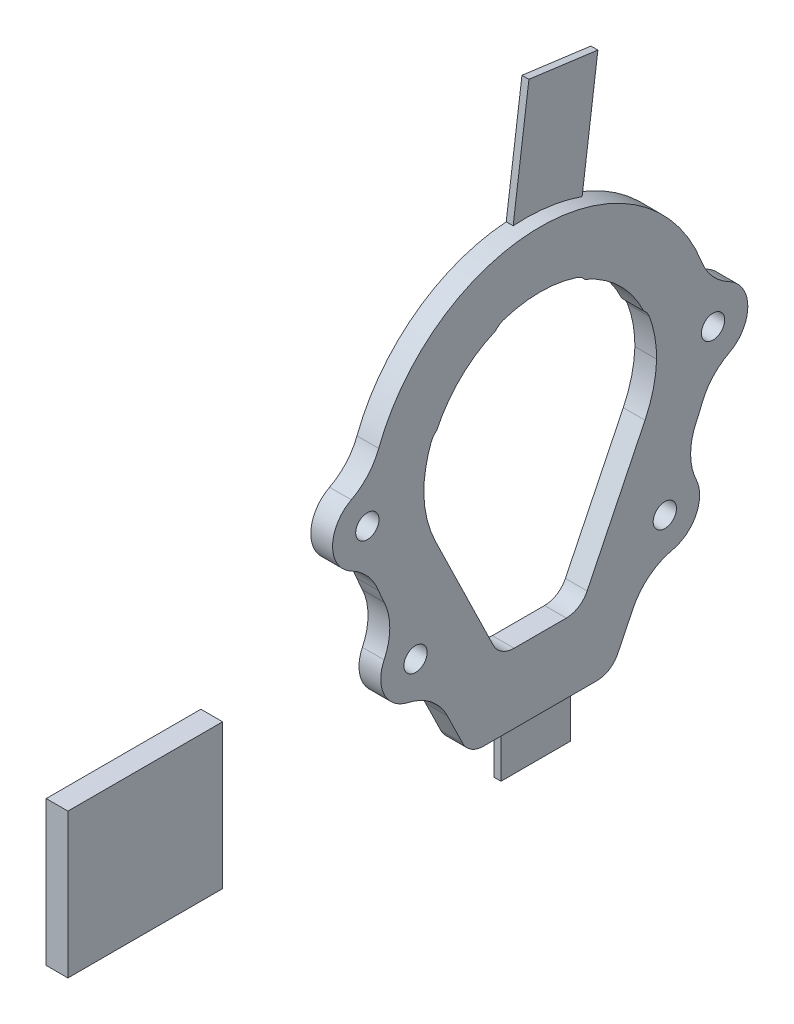
from build123d import *

# Parameters (mm, degrees)
BOSS_EXTRUDE1_DEPTH    = 4.7625
FILLET1_R              = 25.4
FILLET2_R              = 5.08
SKETCH2_R              = 7.62
BOSS_EXTRUDE2_DEPTH    = 4.7625
FILLET3_R              = 12.7
F_10_CLEARANCE_HOLE1_D = 5.1054
SKETCH6_W              = 33.890127471
SKETCH6_H              = 31.661537848
BOSS_EXTRUDE3_DEPTH    = 4.7625
SKETCH7_W              = 15.24
SKETCH7_H              = 11.811391345
BOSS_EXTRUDE4_DEPTH    = 1.524


with BuildPart() as part:
    # Sketch1 → Boss-Extrude1 (new body)
    with BuildSketch(Plane(origin=(0, 0, 0), x_dir=(0, 0, -1), z_dir=(1, 0, 0))):
        with BuildLine():
            Line((-15.600146512, -54.464), (15.600146512, -54.464))
            Line((15.600146512, -54.464), (34.042431289, -16.566091146))
            ThreePointArc((34.042431289, -16.566091146), (0, 37.85924595), (-34.042431289, -16.566091146))
            Line((-34.042431289, -16.566091146), (-15.600146512, -54.464))
        make_face()
        with BuildLine():
            Line((25.508, 0), (25.508, -5.08))
            Line((25.508, -5.08), (10.282855133, -36.366858404))
            ThreePointArc((10.282855133, -36.366858404), (8.408907878, -38.450885226), (5.715, -39.224))
            Line((5.715, -39.224), (-5.715, -39.224))
            ThreePointArc((-5.715, -39.224), (-8.408907878, -38.450885226), (-10.282855133, -36.366858404))
            Line((-10.282855133, -36.366858404), (-25.508, -5.08))
            Line((-25.508, -5.08), (-25.508, 0))
            ThreePointArc((-25.508, 0), (-25.107901196, 4.500151281), (-23.920156064, 8.859130762))
            ThreePointArc((-23.920156064, 8.859130762), (-23.410150406, 9.801984571), (-22.657694676, 10.565456544))
            ThreePointArc((-22.657694676, 10.565456544), (-17.366459261, 17.983495008), (-9.768278212, 23.012621336))
            ThreePointArc((-9.768278212, 23.012621336), (-8.979011, 23.737973903), (-8.018932611, 24.214763756))
            ThreePointArc((-8.018932611, 24.214763756), (0, 25.508), (8.018932611, 24.214763756))
            ThreePointArc((8.018932611, 24.214763756), (8.979011, 23.737973903), (9.768278212, 23.012621336))
            ThreePointArc((9.768278212, 23.012621336), (17.366459261, 17.983495008), (22.657694676, 10.565456544))
            ThreePointArc((22.657694676, 10.565456544), (23.410150406, 9.801984571), (23.920156064, 8.859130762))
            ThreePointArc((23.920156064, 8.859130762), (25.107901196, 4.500151281), (25.508, 0))
        make_face(mode=Mode.SUBTRACT)
    extrude(amount=BOSS_EXTRUDE1_DEPTH)

    # Fillet1
    # the kernel refuses this fillet: 25.4 mm, written as the material it adds along each edge
    with BuildSketch(Plane(origin=(0, -5.08, 25.508), x_dir=(0, -0.8991840813100413, -0.43757055193261923), z_dir=(1, 0, 0))) as fillet1_piece_1:
        with BuildLine():
            CenterArc((5.823492587, 25.4), FILLET1_R, 245.851175762, 24.148824238)
            Line((-4.567855133, 2.222858404), (-4.775682087, 1.759315572))
            ThreePointArc((-4.775682087, 1.759315572), (-2.506213407, 0.654643689), (-0.22228584, -0.456785513))
            Line((-0.22228584, -0.456785513), (0, -0.508))
            Line((0, -0.508), (5.823492587, -0.508))
            Line((5.823492587, -0.508), (5.823492587, 0))
        make_face()
    extrude(amount=4.7625)
    with BuildSketch(Plane(origin=(0, -5.08, -25.508), x_dir=(0, 1, 0), z_dir=(1, 0, 0))) as fillet1_piece_2:
        with BuildLine():
            CenterArc((5.877900188, 25.387464531), FILLET1_R, 244.051024762, 24.148824238)
            Line((-5.236391831, 2.548188865), (-5.458677672, 2.091403352))
            Line((-5.458677672, 2.091403352), (-0.22228584, -0.456785513))
            Line((-0.22228584, -0.456785513), (0, -0.508))
            ThreePointArc((0, -0.508), (2.54, -0.508), (5.064041996, -0.507749291))
            Line((5.064041996, -0.507749291), (5.08, 0))
        make_face()
    extrude(amount=4.7625)

    # Fillet2
    fillet2_edges = [part.edges().sort_by_distance(p)[0] for p in [
        (2.38125, -54.464, -15.600146512),
        (2.38125, -54.464, 15.600146512),
    ]]
    fillet(fillet2_edges, radius=FILLET2_R)

    # Sketch2 → Boss-Extrude2 (add, through all)
    with BuildSketch(Plane(origin=(4.7625, 0, 0), x_dir=(0, 0, -1), z_dir=(1, 0, 0))):
        with Locations((37.85924595, 0)):
            Circle(SKETCH2_R)
        with Locations((-37.85924595, 0)):
            Circle(SKETCH2_R)
        with Locations((-27.305, -30.48)):
            Circle(SKETCH2_R)
        with Locations((27.305, -30.48)):
            Circle(SKETCH2_R)
    extrude(amount=-BOSS_EXTRUDE2_DEPTH)

    # Fillet3
    fillet3_edges = [part.edges().sort_by_distance(p)[0] for p in [
        (2.38125, -7.581315695, -37.092400249),
        (2.38125, 7.581315695, -37.092400249),
        (2.38125, 7.581315695, 37.092400249),
        (2.38125, -7.581315695, 37.092400249),
        (2.38125, -37.318546983, -23.943649801),
        (2.38125, -23.61508868, -30.612172896),
        (2.38125, -23.61508868, 30.612172896),
        (2.38125, -37.318546983, 23.943649801),
    ]]
    fillet(fillet3_edges, radius=FILLET3_R)

    # #10 Clearance Hole1 (through all)
    with Locations(Plane(origin=(4.7625, 0, 0), x_dir=(0, 0, -1), z_dir=(1, 0, 0))):
        with Locations((-37.85924595, 0), (37.85924595, 0), (27.305, -30.48), (-27.305, -30.48)):
            Hole(F_10_CLEARANCE_HOLE1_D / 2)

    # Sketch7 → Boss-Extrude4 (add)
    with BuildSketch(Plane.ZY):
        with Locations((-2.270075224, -60.369695673)):
            Rectangle(SKETCH7_W, SKETCH7_H)
        Polygon((-12.422664108, 35.763108371), (2.685429581, 37.763884491), (-0.767111353, 63.83442351), (-15.875205043, 61.83364739), align=None)
    extrude(amount=-BOSS_EXTRUDE4_DEPTH)


with BuildPart() as body_2:
    # Sketch6 → Boss-Extrude3 (new body)
    with BuildSketch(Plane(origin=(4.7625, 0, 0), x_dir=(0, 0, -1), z_dir=(1, 0, 0))):
        with Locations((-86.503934592, -37.085978952)):
            Rectangle(SKETCH6_W, SKETCH6_H)
    extrude(amount=-BOSS_EXTRUDE3_DEPTH)


solid = Compound([part.part, body_2.part])
